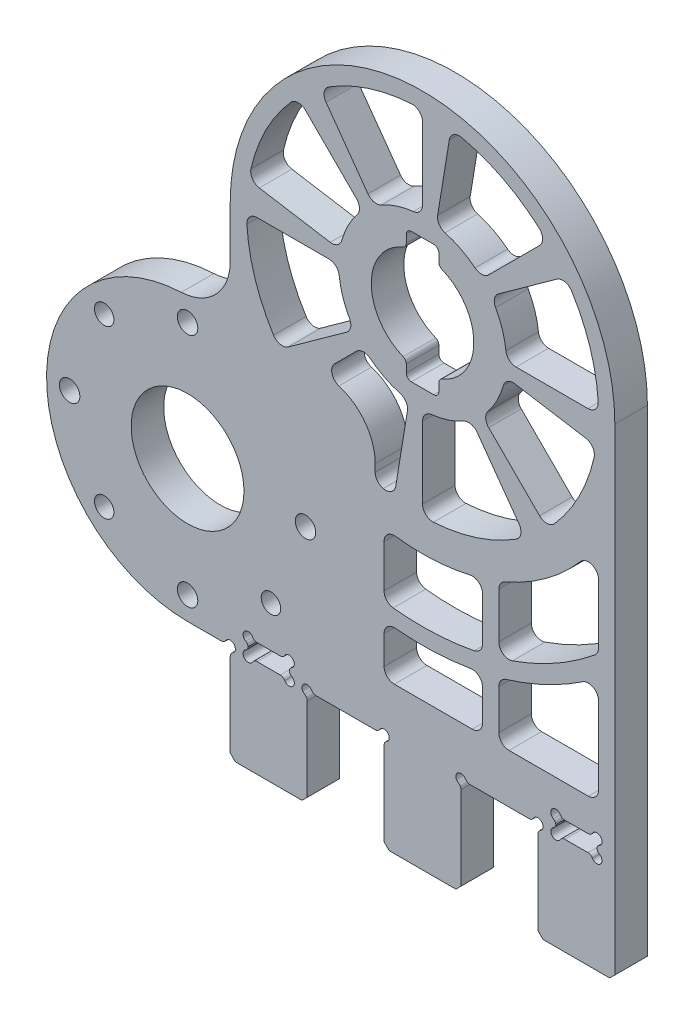
from build123d import *

# Parameters (mm, degrees)
SKETCH1_R                = 11
SKETCH1_R_2              = 10
SKETCH1_R_3              = 1.89865
SKETCH1_R_4              = 1.9939
BOSS_EXTRUDE1_DEPTH      = 6.35
SKETCH2_W                = 15
SKETCH2_H                = 19.05
BOSS_EXTRUDE2_DEPTH      = 6.35
CHAMFER1_SIZE            = 1
SKETCH3_R                = 1
CUT_EXTRUDE1_DEPTH       = 159.045298218
FILLET1_R                = 10
FILLET2_R                = 1
SKETCH4_W                = 7.99338
SKETCH4_H                = 3.22072
CUT_EXTRUDE2_DEPTH       = 159.045298363
CUT_EXTRUDE5_DEPTH       = 159.045298363
FILLET7_R                = 2
CIRPATTERN1_COUNT        = 8
FILLET7_OF_CIRPATTERN1_R = 2
BOSS_EXTRUDE3_DEPTH      = 6.35
FILLET12_R               = 2
SKETCH11_R               = 1
CUT_EXTRUDE6_DEPTH       = 159.045298363
FILLET13_R               = 1
SKETCH12_W               = 6.35
SKETCH12_H               = 3.217417282
CUT_EXTRUDE7_DEPTH       = 159.045298363
FILLET14_R               = 1
CUT_EXTRUDE8_DEPTH       = 159.045298363
FILLET15_R               = 2


with BuildPart() as part:
    # Sketch1 → Boss-Extrude1 (new body)
    with BuildSketch(Plane.XY):
        with BuildLine():
            Line((-40.498784978, 0), (0, 0))
            Line((0, 0), (0, 75))
            ThreePointArc((0, 75), (-37.5, 112.5), (-75, 75))
            Line((-75, 75), (-75, 55))
            Line((-75, 55), (-83.323029145, 55))
            ThreePointArc((-83.323029145, 55), (-110.823029145, 27.5), (-83.323029145, 0))
            Line((-83.323029145, 0), (-40.498784978, 0))
        make_face()
        with Locations((-83.323029145, 27.5)):
            Circle(SKETCH1_R, mode=Mode.SUBTRACT)
        with Locations((-37.5, 75)):
            Circle(SKETCH1_R_2, mode=Mode.SUBTRACT)
        with Locations((-67.059573177, 11.236544033)):
            Circle(SKETCH1_R_3, mode=Mode.SUBTRACT)
        with Locations((-83.323029145, 50.5)):
            Circle(SKETCH1_R_4, mode=Mode.SUBTRACT)
        with Locations((-99.586485112, 11.236544033)):
            Circle(SKETCH1_R_3, mode=Mode.SUBTRACT)
        with Locations((-60.323029145, 27.5)):
            Circle(SKETCH1_R_4, mode=Mode.SUBTRACT)
        with Locations((-99.586485112, 43.763455967)):
            Circle(SKETCH1_R_3, mode=Mode.SUBTRACT)
        with Locations((-83.323029145, 4.5)):
            Circle(SKETCH1_R_4, mode=Mode.SUBTRACT)
        with Locations((-106.323029145, 27.5)):
            Circle(SKETCH1_R_4, mode=Mode.SUBTRACT)
    extrude(amount=BOSS_EXTRUDE1_DEPTH)

    # Sketch2 → Boss-Extrude2 (add)
    with BuildSketch(Plane(origin=(0, 0, 0), x_dir=(-1, 0, 0), z_dir=(0, 0, -1))):
        with Locations((7.5, -9.525)):
            Rectangle(SKETCH2_W, SKETCH2_H)
        with Locations((37.5, -9.525)):
            Rectangle(SKETCH2_W, SKETCH2_H)
        with Locations((67.5, -9.525)):
            Rectangle(SKETCH2_W, SKETCH2_H)
    extrude(amount=-BOSS_EXTRUDE2_DEPTH)

    # Chamfer1
    chamfer1_edges = [part.edges().sort_by_distance(p)[0] for p in [
        (0, -19.05, 3.175),
        (-15, -19.05, 3.175),
        (-30, -19.05, 3.175),
        (-45, -19.05, 3.175),
        (-60, -19.05, 3.175),
        (-75, -19.05, 3.175),
    ]]
    chamfer(chamfer1_edges, length=CHAMFER1_SIZE)

    # Sketch3 → Cut-Extrude1 (cut, through all)
    with BuildSketch(Plane.XY.offset(6.35)):
        with Locations((-75, 0)):
            Circle(SKETCH3_R)
        with Locations((-60, 0)):
            Circle(SKETCH3_R)
        with Locations((-45, 0)):
            Circle(SKETCH3_R)
        with Locations((-30, 0)):
            Circle(SKETCH3_R)
        with Locations((-15, 0)):
            Circle(SKETCH3_R)
    extrude(amount=-CUT_EXTRUDE1_DEPTH, mode=Mode.SUBTRACT)

    # Fillet1
    fillet1_edges = [part.edges().sort_by_distance(p)[0] for p in [
        (-75, 55, 3.175),
    ]]
    fillet(fillet1_edges, radius=FILLET1_R)

    # Fillet2
    fillet2_edges = [part.edges().sort_by_distance(p)[0] for p in [
        (-75, -1, 3.175),
        (-76, 0, 3.175),
        (-60, -1, 3.175),
        (-59, 0, 3.175),
        (-45, -1, 3.175),
        (-46, 0, 3.175),
        (-30, -1, 3.175),
        (-29, 0, 3.175),
        (-15, -1, 3.175),
        (-16, 0, 3.175),
    ]]
    fillet(fillet2_edges, radius=FILLET2_R)

    # Sketch4 → Cut-Extrude2 (cut, through all)
    with BuildSketch(Plane.XY.offset(6.35)):
        with Locations((-67.5, 1.61036)):
            Rectangle(SKETCH4_W, SKETCH4_H)
        with Locations((-7.5, 1.61036)):
            Rectangle(SKETCH4_W, SKETCH4_H)
    extrude(amount=-CUT_EXTRUDE2_DEPTH, mode=Mode.SUBTRACT)

    # Sketch7 → Cut-Extrude5 (cut, through all)
    with BuildSketch(Plane(origin=(0, 0, 0), x_dir=(-1, 0, 0), z_dir=(0, 0, -1))):
        with BuildLine():
            Line((50.778435289, 65.460311521), (65.37659274, 54.972488867))
            ThreePointArc((65.37659274, 54.972488867), (70.173151599, 64.479981483), (71.825, 75))
            Line((71.825, 75), (53.85, 75))
            ThreePointArc((53.85, 75), (53.063176362, 69.989007931), (50.778435289, 65.460311521))
        make_face()
    cut_extrude5 = extrude(amount=-CUT_EXTRUDE5_DEPTH, mode=Mode.SUBTRACT)

    # Fillet7
    fillet7_edges = [part.edges().sort_by_distance(p)[0] for p in [
        (-50.778435289, 65.460311521, 3.175),
        (-53.85, 75, 3.175),
        (-71.825, 75, 3.175),
        (-65.37659274, 54.972488867, 3.175),
    ]]
    fillet(fillet7_edges, radius=FILLET7_R)

    # CirPattern1: Cut-Extrude5 ×8 about axis
    cirpattern1_axis = Axis((-37.5, 75, 0), (0, 0, 1))
    for i in range(1, CIRPATTERN1_COUNT):
        add(cut_extrude5.rotate(cirpattern1_axis, i * 360 / CIRPATTERN1_COUNT), mode=Mode.SUBTRACT)

    # Fillet7 of CirPattern1
    fillet7_of_cirpattern1_edges = [part.edges().sort_by_distance(p)[0] for p in [
        (-40.143693223, 58.86514995, 3.175),
        (-49.061195872, 63.438804128, 3.175),
        (-61.771440264, 50.728559736, 3.175),
        (-43.05013883, 41.126683304, 3.175),
        (-27.960311521, 61.721564711, 3.175),
        (-37.5, 58.65, 3.175),
        (-37.5, 40.675, 3.175),
        (-17.472488867, 47.12340726, 3.175),
        (-21.36514995, 72.356306777, 3.175),
        (-25.938804128, 63.438804128, 3.175),
        (-13.228559736, 50.728559736, 3.175),
        (-3.626683304, 69.44986117, 3.175),
        (-24.221564711, 84.539688479, 3.175),
        (-21.15, 75, 3.175),
        (-3.175, 75, 3.175),
        (-9.62340726, 95.027511133, 3.175),
        (-34.856306777, 91.13485005, 3.175),
        (-25.938804128, 86.561195872, 3.175),
        (-13.228559736, 99.271440264, 3.175),
        (-31.94986117, 108.873316696, 3.175),
        (-47.039688479, 88.278435289, 3.175),
        (-37.5, 91.35, 3.175),
        (-37.5, 109.325, 3.175),
        (-57.527511133, 102.87659274, 3.175),
        (-53.63485005, 77.643693223, 3.175),
        (-49.061195872, 86.561195872, 3.175),
        (-61.771440264, 99.271440264, 3.175),
        (-71.373316696, 80.55013883, 3.175),
    ]]
    fillet(fillet7_of_cirpattern1_edges, radius=FILLET7_OF_CIRPATTERN1_R)

    # Sketch10 → Boss-Extrude3 (add, through all)
    with BuildSketch(Plane(origin=(0, 0, 0), x_dir=(-1, 0, 0), z_dir=(0, 0, -1))):
        with BuildLine():
            Line((56.732050808, 54.972488867), (71.546317062, 54.972488867))
            Line((71.546317062, 54.972488867), (71.546317062, 34.368678229))
            Line((71.546317062, 34.368678229), (46.732050808, 34.368678229))
            Line((46.732050808, 34.368678229), (46.732050808, 44.972488867))
            ThreePointArc((46.732050808, 44.972488867), (49.660982996, 52.043556679), (56.732050808, 54.972488867))
        make_face()
    extrude(amount=-BOSS_EXTRUDE3_DEPTH)

    # Fillet12
    fillet12_edges = [part.edges().sort_by_distance(p)[0] for p in [
        (-57.527511133, 54.972488867, 3.175),
        (-46.732050808, 41.93982966, 3.175),
    ]]
    fillet(fillet12_edges, radius=FILLET12_R)

    # Sketch11 → Cut-Extrude6 (cut, through all)
    with BuildSketch(Plane.XY.offset(6.35)):
        with Locations((-71.49669, 3.22072)):
            Circle(SKETCH11_R)
        with Locations((-63.50331, 3.22072)):
            Circle(SKETCH11_R)
        with Locations((-63.50331, 0)):
            Circle(SKETCH11_R)
        with Locations((-71.49669, 0)):
            Circle(SKETCH11_R)
        with Locations((-11.49669, 3.22072)):
            Circle(SKETCH11_R)
        with Locations((-3.50331, 3.22072)):
            Circle(SKETCH11_R)
        with Locations((-3.50331, 0)):
            Circle(SKETCH11_R)
        with Locations((-11.49669, 0)):
            Circle(SKETCH11_R)
    extrude(amount=-CUT_EXTRUDE6_DEPTH, mode=Mode.SUBTRACT)

    # Fillet13
    # the kernel refuses this fillet: 1 mm, written as the material it takes off along each edge
    with BuildSketch(Plane(origin=(-71.49669, 2.22072, -1.830127019), x_dir=(-0.9659258262890682, 0.25881904510252124, 0), z_dir=(0, 0, 1)), Plane(origin=(-63.50331, 1, -1.830127019), x_dir=(0.9659258262890688, -0.25881904510251885, 0), z_dir=(0, 0, 1)), Plane(origin=(-64.50331, 3.22072, -1.830127019), x_dir=(0.2588190451025049, 0.9659258262890725, 0), z_dir=(0, 0, 1)), Plane(origin=(-4.50331, 3.22072, -1.830127019), x_dir=(0.25881904510252124, 0.9659258262890682, 0), z_dir=(0, 0, 1)), Plane(origin=(-3.50331, 1, -1.830127019), x_dir=(0.9659258262890684, -0.2588190451025207, 0), z_dir=(0, 0, 1)), Plane(origin=(-11.49669, 2.22072, -1.830127019), x_dir=(-0.9659258262890682, 0.25881904510252124, 0), z_dir=(0, 0, 1))) as fillet13_piece_1:
        with BuildLine():
            CenterArc((0.776457135, 0.965925826), FILLET13_R, 195, 60)
            Line((-0.189468691, 0.707106781), (0, 0))
            ThreePointArc((0, 0), (0.258819045, 0.034074174), (0.51763809, 0))
        make_face()
    extrude(amount=10.010254038, mode=Mode.SUBTRACT)
    with BuildSketch(Plane(origin=(-71.49669, 1, -1.830127019), x_dir=(0, 1, 0), z_dir=(0, 0, 1)), Plane(origin=(-63.50331, 2.22072, -1.830127019), x_dir=(0, -1, 0), z_dir=(0, 0, 1)), Plane(origin=(-3.50331, 2.22072, -1.830127019), x_dir=(0, -1, 0), z_dir=(0, 0, 1)), Plane(origin=(-11.49669, 1, -1.830127019), x_dir=(0, 1, 0), z_dir=(0, 0, 1))) as fillet13_piece_2:
        with BuildLine():
            CenterArc((0.732050808, 1), FILLET13_R, 210, 60)
            ThreePointArc((-0.133974596, 0.5), (-0.034074174, 0.258819045), (0, 0))
            Line((0, 0), (0.732050808, 0))
        make_face()
    extrude(amount=10.010254038, mode=Mode.SUBTRACT)
    with BuildSketch(Plane(origin=(-70.49669, 0, 8.180127019), x_dir=(-0.25881904510253045, -0.9659258262890658, 0), z_dir=(0, 0, -1)), Plane(origin=(-64.50331, 0, -1.830127019), x_dir=(0.2588190451025049, -0.9659258262890725, 0), z_dir=(0, 0, 1)), Plane(origin=(-4.50331, 0, -1.830127019), x_dir=(0.2588190451025212, -0.9659258262890682, 0), z_dir=(0, 0, 1)), Plane(origin=(-10.49669, 0, 8.180127019), x_dir=(-0.25881904510251935, -0.9659258262890686, 0), z_dir=(0, 0, -1))) as fillet13_piece_3:
        with BuildLine():
            CenterArc((0.776457135, -0.965925826), FILLET13_R, 105, 60)
            Line((-0.189468691, -0.707106781), (0, 0))
            ThreePointArc((0, 0), (0.258819045, -0.034074174), (0.51763809, 0))
        make_face()
    extrude(amount=10.010254038, mode=Mode.SUBTRACT)
    with BuildSketch(Plane(origin=(-70.49669, 3.22072, 8.180127019), x_dir=(1, 0, 0), z_dir=(0, 0, -1)), Plane(origin=(-10.49669, 3.22072, 8.180127019), x_dir=(1, 0, 0), z_dir=(0, 0, -1))) as fillet13_piece_4:
        with BuildLine():
            CenterArc((0.732050808, -1), FILLET13_R, 90, 60)
            ThreePointArc((-0.133974596, -0.5), (-0.034074174, -0.258819045), (0, 0))
            Line((0, 0), (0.732050808, 0))
        make_face()
    extrude(amount=10.010254038, mode=Mode.SUBTRACT)

    # Sketch12 → Cut-Extrude7 (cut, through all)
    with BuildSketch(Plane(origin=(0, 0, 0), x_dir=(-1, 0, 0), z_dir=(0, 0, -1))):
        with Locations((37.5, 86.091291359)):
            Rectangle(SKETCH12_W, SKETCH12_H)
        with Locations((37.5, 63.908708641)):
            Rectangle(SKETCH12_W, SKETCH12_H)
    extrude(amount=-CUT_EXTRUDE7_DEPTH, mode=Mode.SUBTRACT)

    # Fillet14
    fillet14_edges = [part.edges().sort_by_distance(p)[0] for p in [
        (-40.675, 84.482582718, 3.175),
        (-34.325, 84.482582718, 3.175),
        (-34.325, 87.7, 3.175),
        (-40.675, 87.7, 3.175),
        (-34.325, 62.3, 3.175),
        (-34.325, 65.517417282, 3.175),
        (-40.675, 65.517417282, 3.175),
        (-40.675, 62.3, 3.175),
    ]]
    fillet(fillet14_edges, radius=FILLET14_R)

    # Sketch13 → Cut-Extrude8 (cut, through all)
    with BuildSketch(Plane(origin=(0, 0, 0), x_dir=(-1, 0, 0), z_dir=(0, 0, -1))):
        with BuildLine():
            Line((22.631029277, 24.165216576), (22.631029277, 37.14013557))
            ThreePointArc((22.631029277, 37.14013557), (11.629056482, 43.612902229), (3.175, 53.176847157))
            Line((3.175, 53.176847157), (3.175, 34.663219376))
            ThreePointArc((3.175, 34.663219376), (12.349180837, 28.387793535), (22.631029277, 24.165216576))
        make_face()
        with BuildLine():
            Line((25.806029277, 23.342352504), (25.806029277, 36.042245012))
            ThreePointArc((25.806029277, 36.042245012), (35.341910516, 34.382291119), (45, 35.02243598))
            Line((45, 35.02243598), (45, 22.568983453))
            ThreePointArc((45, 22.568983453), (35.367660316, 22.078221651), (25.806029277, 23.342352504))
        make_face()
        with BuildLine():
            Line((22.631029277, 20.865151717), (22.631029277, 9.57072))
            Line((22.631029277, 9.57072), (3.175, 9.57072))
            Line((3.175, 9.57072), (3.175, 30.576329913))
            ThreePointArc((3.175, 30.576329913), (12.428334033, 24.76973368), (22.631029277, 20.865151717))
        make_face()
        with BuildLine():
            Line((25.806029277, 20.091720682), (25.806029277, 9.57072))
            Line((25.806029277, 9.57072), (45, 9.57072))
            Line((45, 9.57072), (45, 19.363518363))
            ThreePointArc((45, 19.363518363), (35.371639772, 18.900640184), (25.806029277, 20.091720682))
        make_face()
    extrude(amount=-CUT_EXTRUDE8_DEPTH, mode=Mode.SUBTRACT)

    # Fillet15
    fillet15_edges = [part.edges().sort_by_distance(p)[0] for p in [
        (-22.631029277, 24.165216576, 3.175),
        (-3.175, 34.663219376, 3.175),
        (-3.175, 53.176847157, 3.175),
        (-22.631029277, 37.14013557, 3.175),
        (-25.806029277, 36.042245012, 3.175),
        (-45, 35.02243598, 3.175),
        (-45, 22.568983453, 3.175),
        (-25.806029277, 23.342352504, 3.175),
        (-45, 9.57072, 3.175),
        (-25.806029277, 9.57072, 3.175),
        (-25.806029277, 20.091720682, 3.175),
        (-45, 19.363518363, 3.175),
        (-3.175, 9.57072, 3.175),
        (-3.175, 30.576329913, 3.175),
        (-22.631029277, 20.865151717, 3.175),
        (-22.631029277, 9.57072, 3.175),
    ]]
    fillet(fillet15_edges, radius=FILLET15_R)


solid = part.part
